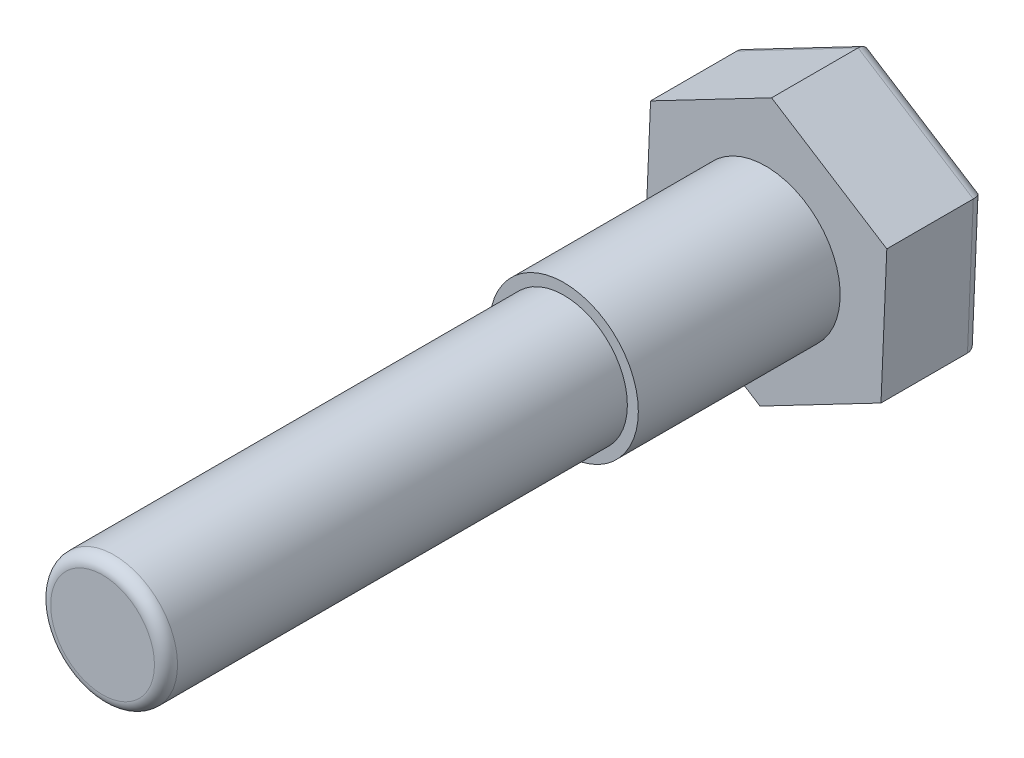
from build123d import *

# Parameters (mm, degrees)
EXTRUDE_308_DEPTH = 17
SKETCH_2_R        = 12.9
EXTRUDE_1_DEPTH   = 35
FILLET_3_R        = 2
SKETCH_3_R        = 11
EXTRUDE_2_DEPTH   = 80
FILLET_4_R        = 2


with BuildPart() as part:
    # 草图1 → Extrude 308 (new body)
    with BuildSketch(Plane.XY):
        Polygon((20.984201837, 10.954296262), (1.005402075, 23.65), (-19.978799762, 12.695703738), (-20.984201837, -10.954296262), (-1.005402075, -23.65), (19.978799762, -12.695703738), align=None)
    extrude(amount=EXTRUDE_308_DEPTH)

    # 草图2 → 凸台-拉伸1 (add)
    with BuildSketch(Plane.XY.offset(17)):
        Circle(SKETCH_2_R)
    extrude(amount=EXTRUDE_1_DEPTH)

    # 圆角3
    fillet_3_edges = [part.edges().sort_by_distance(p)[0] for p in [
        (10.994801956, 17.302148131, 0),
        (-9.486698843, 18.172851869, 0),
        (-20.4815008, 0.870703738, 0),
        (-10.994801956, -17.302148131, 0),
        (9.486698843, -18.172851869, 0),
        (20.4815008, -0.870703738, 0),
    ]]
    fillet(fillet_3_edges, radius=FILLET_3_R)

    # 草图3 → 凸台-拉伸2 (add)
    with BuildSketch(Plane.XY.offset(52)):
        Circle(SKETCH_3_R)
    extrude(amount=EXTRUDE_2_DEPTH)

    # 圆角4
    fillet_4_edges = [part.edges().sort_by_distance(p)[0] for p in [
        (-11, 0, 132),
    ]]
    fillet(fillet_4_edges, radius=FILLET_4_R)


solid = part.part
